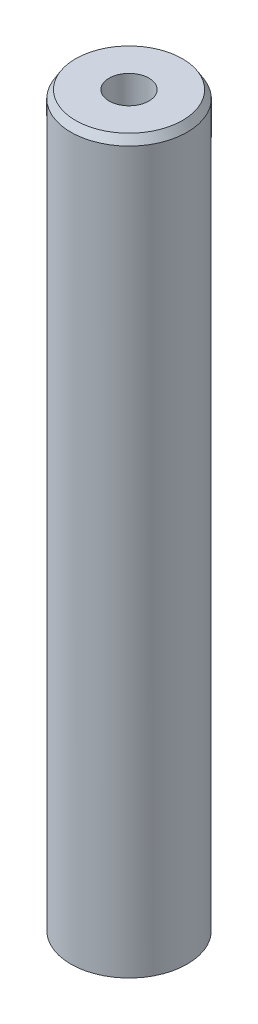
from build123d import *
from OCP.BRepFilletAPI import BRepFilletAPI_MakeChamfer

# Parameters (mm, degrees)
SKETCH1_R           = 12.5
BOSS_EXTRUDE1_DEPTH = 157.45169728
SKETCH2_R           = 4.274383863
CUT_EXTRUDE1_DEPTH  = 159.440957382
CHAMFER1_SIZE       = 1.680759111
CHAMFER1_SIZE2      = 1.015279983


with BuildPart() as part:
    # Sketch1 → Boss-Extrude1 (new body)
    with BuildSketch(Plane(origin=(0, 0, 0), x_dir=(1, 0, 0), z_dir=(0, 1, 0))):
        Circle(SKETCH1_R)
    extrude(amount=BOSS_EXTRUDE1_DEPTH)

    # Sketch2 → Cut-Extrude1 (cut, through all)
    with BuildSketch(Plane(origin=(0, 0, 0), x_dir=(1, 0, 0), z_dir=(0, 1, 0))):
        Circle(SKETCH2_R)
    extrude(amount=CUT_EXTRUDE1_DEPTH, mode=Mode.SUBTRACT)

    # Chamfer1: one chamfer whose edges measure the first distance from different faces: ONE call of the kernel's chamfer builder (chamfer() names one face for all edges)
    chamfer1_edges_1 = [part.edges().sort_by_distance(p)[0] for p in [
        (-12.5, 157.45169728, 0),
    ]]
    chamfer1_side_1 = [part.faces().sort_by_distance(p)[0] for p in [
        (-12.5, 78.72584864, 0),
    ]]
    chamfer1_edges_2 = [part.edges().sort_by_distance(p)[0] for p in [
        (-12.5, 0, 0),
    ]]
    chamfer1_side_2 = [part.faces().sort_by_distance(p)[0] for p in [
        (-12.146446609, 0, 0),
    ]]
    chamfer1 = BRepFilletAPI_MakeChamfer(part.part.solid().wrapped)
    for e in chamfer1_edges_1:
        chamfer1.Add(CHAMFER1_SIZE, CHAMFER1_SIZE2, e.wrapped, chamfer1_side_1[0].wrapped)  # the first distance lies on this face
    for e in chamfer1_edges_2:
        chamfer1.Add(CHAMFER1_SIZE, CHAMFER1_SIZE2, e.wrapped, chamfer1_side_2[0].wrapped)  # the first distance lies on this face
    add(Compound.cast(chamfer1.Shape()), mode=Mode.REPLACE)


solid = part.part
